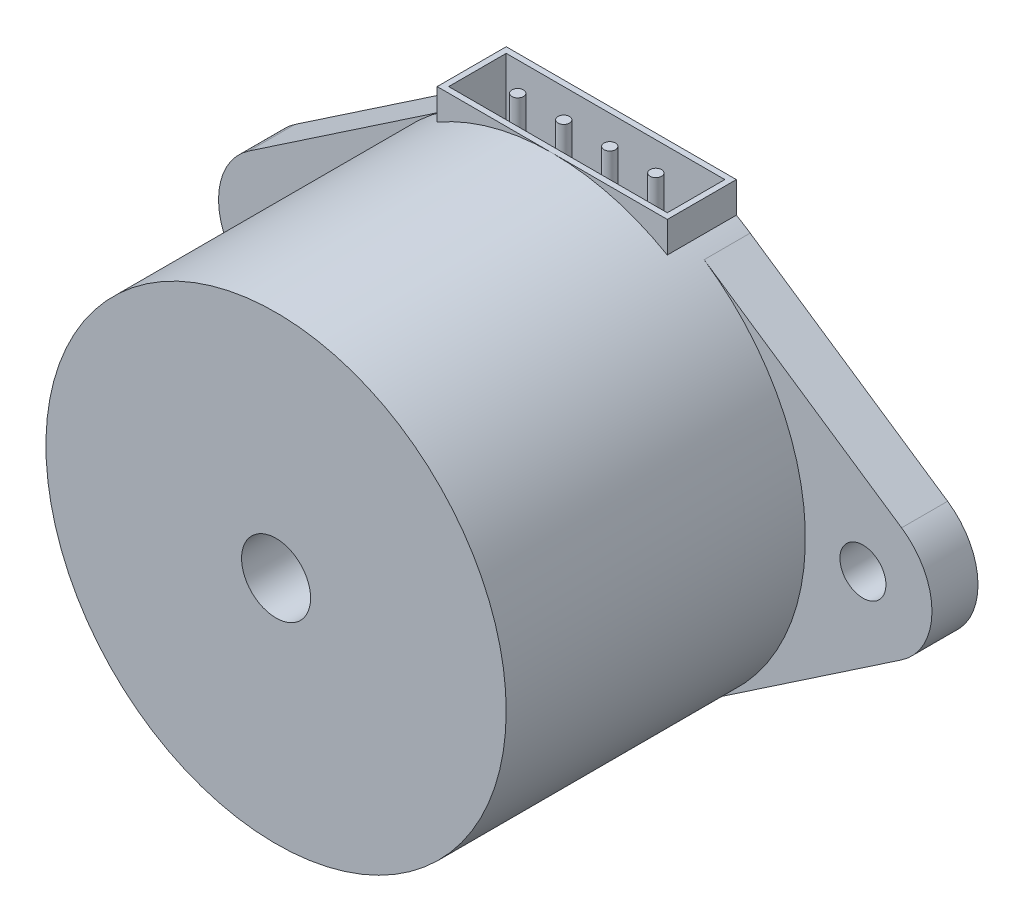
from build123d import *

# Parameters (mm, degrees)
SKETCH1_R               = 10
BOSS_EXTRUDE1_DEPTH     = 15
BOSS_EXTRUDE2_START     = -2
BOSS_EXTRUDE2_OUTLINE_R = 1
BOSS_EXTRUDE2_DEPTH     = 2
SKETCH3_W               = 10
SKETCH3_H               = 3
BOSS_EXTRUDE3_DEPTH     = 2
SKETCH4_W               = 9.5
SKETCH4_H               = 2.5
SKETCH4_R               = 0.25
CUT_EXTRUDE1_DEPTH      = 3
SKETCH5_R               = 1.5
CUT_EXTRUDE2_DEPTH      = 3


# Read off the part's stored shape, not the designer's step: Boss-Extrude2
with BuildPart() as part:
    # Sketch1 → Boss-Extrude1 (new body)
    with BuildSketch(Plane.XY):
        Circle(SKETCH1_R)
    extrude(amount=BOSS_EXTRUDE1_DEPTH)

    # Boss-Extrude2 outline → Boss-Extrude2 (add)
    # profile 1 of 2: a face of its own
    with BuildSketch(Plane(origin=(0, 0, 0), x_dir=(-1, 0, 0), z_dir=(0, 0, -1)).offset(BOSS_EXTRUDE2_START)):
        with BuildLine():
            Line((5.599999975, -8.284926088), (14.179999754, -2.485477473))
            ThreePointArc((14.179999754, -2.485477473), (15.499999574, 0), (14.179999754, 2.485477473))
            Line((14.179999754, 2.485477473), (5.599999975, 8.284926088))
            ThreePointArc((5.599999975, 8.284926088), (10, 0), (5.599999975, -8.284926088))
        make_face()
        with Locations((12.5, 0)):
            Circle(BOSS_EXTRUDE2_OUTLINE_R, mode=Mode.SUBTRACT)
    # profile 2 of 2: a face of its own
    with BuildSketch(Plane(origin=(0, 0, 0), x_dir=(-1, 0, 0), z_dir=(0, 0, -1)).offset(BOSS_EXTRUDE2_START)):
        with BuildLine():
            Line((-14.179999754, -2.485477473), (-5.599999975, -8.284926088))
            ThreePointArc((-5.599999975, -8.284926088), (-10, 0), (-5.599999975, 8.284926088))
            Line((-5.599999975, 8.284926088), (-14.179999754, 2.485477473))
            ThreePointArc((-14.179999754, 2.485477473), (-15.499999574, 0), (-14.179999754, -2.485477473))
        make_face()
        with Locations((-12.5, 0)):
            Circle(BOSS_EXTRUDE2_OUTLINE_R, mode=Mode.SUBTRACT)
    extrude(amount=BOSS_EXTRUDE2_DEPTH)

    # Sketch3 → Boss-Extrude3 (add)
    with BuildSketch(Plane(origin=(0, 10, 0), x_dir=(1, 0, 0), z_dir=(0, 1, 0))):
        with Locations((0, -1.5)):
            Rectangle(SKETCH3_W, SKETCH3_H)
    extrude(amount=-BOSS_EXTRUDE3_DEPTH)

    # Sketch4 → Cut-Extrude1 (cut)
    with BuildSketch(Plane(origin=(0, 10, 0), x_dir=(1, 0, 0), z_dir=(0, 1, 0))):
        with Locations((0, -1.5)):
            Rectangle(SKETCH4_W, SKETCH4_H)
        with Locations(Location((-3, -1.5, 0), (0, 0, 270))):
            Circle(SKETCH4_R, mode=Mode.SUBTRACT)
        with Locations(Location((-1, -1.5, 0), (0, 0, 270))):
            Circle(SKETCH4_R, mode=Mode.SUBTRACT)
        with Locations(Location((1, -1.5, 0), (0, 0, 270))):
            Circle(SKETCH4_R, mode=Mode.SUBTRACT)
        with Locations(Location((3, -1.5, 0), (0, 0, 270))):
            Circle(SKETCH4_R, mode=Mode.SUBTRACT)
    extrude(amount=-CUT_EXTRUDE1_DEPTH, mode=Mode.SUBTRACT)

    # Sketch5 → Cut-Extrude2 (cut)
    with BuildSketch(Plane.XY.offset(15)):
        Circle(SKETCH5_R)
    extrude(amount=-CUT_EXTRUDE2_DEPTH, mode=Mode.SUBTRACT)


solid = part.part
